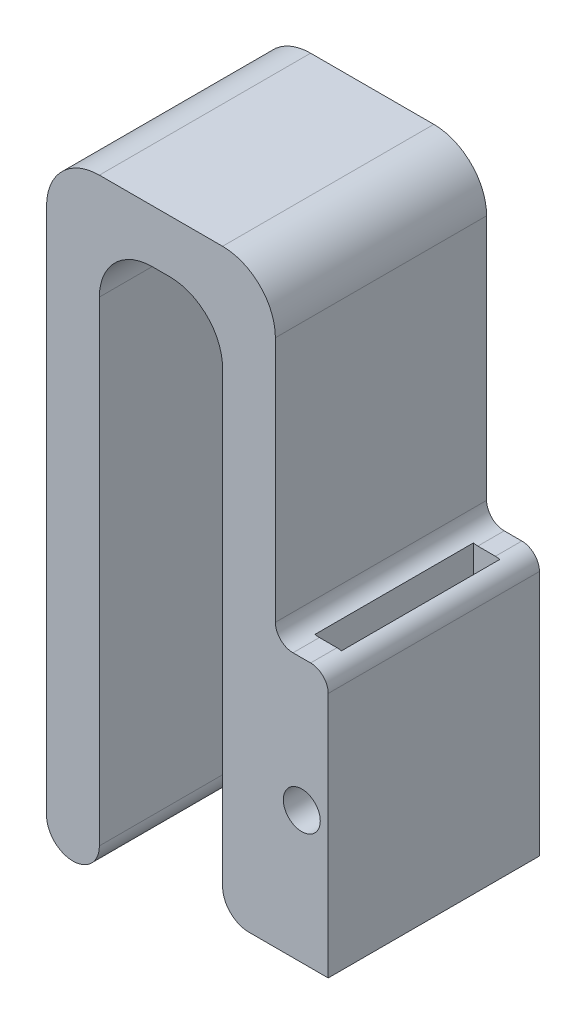
from build123d import *

# Parameters (mm, degrees)
SKETCH1_R           = 1.5
BOSS_EXTRUDE2_DEPTH = 12
SKETCH3_W           = 1.5
SKETCH3_H           = 9
CUT_EXTRUDE2_DEPTH  = 24.832750576
SKETCH4_R           = 1.05
CUT_EXTRUDE3_DEPTH  = 37.510272527
FILLET1_START       = -1
FILLET1_DEPTH       = 14
FILLET1_2_DEPTH     = 12
FILLET1_3_DEPTH     = 1.5
FILLET1_START_2     = 10.5
FILLET1_4_DEPTH     = 1.5


with BuildPart() as part:
    # Sketch1 → Boss-Extrude2 (new body)
    with BuildSketch(Plane.XY):
        with BuildLine():
            ThreePointArc((-10, 0), (-8.5, -1.5), (-7, 0))
            Line((-7, 0), (-10, 0))
        make_face()
        with BuildLine():
            Line((-10, 0), (-7, 0))
            ThreePointArc((-7, 0), (-8.5, 1.5), (-10, 0))
        make_face()
        Polygon((3, 15), (3, 1.5), (3, 0), (6, 0), (6, 15), align=None)
        with BuildLine():
            Line((0, 27), (0, 1.5))
            ThreePointArc((0, 1.5), (1.5, 3), (3, 1.5))
            Line((3, 1.5), (3, 15))
            Line((3, 15), (3, 30))
            ThreePointArc((3, 30), (2.121320344, 32.121320344), (0, 33))
            Line((0, 33), (-7, 33))
            ThreePointArc((-7, 33), (-9.121320344, 32.121320344), (-10, 30))
            Line((-10, 30), (-10, 0))
            ThreePointArc((-10, 0), (-8.5, 1.5), (-7, 0))
            Line((-7, 0), (-7, 27))
            ThreePointArc((-7, 27), (-6.121320344, 29.121320344), (-4, 30))
            Line((-4, 30), (-3, 30))
            ThreePointArc((-3, 30), (-0.878679656, 29.121320344), (0, 27))
        make_face()
        with Locations((1.5, 1.5)):
            Circle(SKETCH1_R)
        with BuildLine():
            ThreePointArc((3, 1.5), (2.560660172, 0.439339828), (1.5, 0))
            Line((1.5, 0), (3, 0))
            Line((3, 0), (3, 1.5))
        make_face()
    extrude(amount=BOSS_EXTRUDE2_DEPTH)

    # Sketch3 → Cut-Extrude2 (cut, through all)
    with BuildSketch(Plane(origin=(0, 15, 0), x_dir=(1, 0, 0), z_dir=(0, 1, 0))):
        with Locations((4.5, -6)):
            Rectangle(SKETCH3_W, SKETCH3_H)
    extrude(amount=-CUT_EXTRUDE2_DEPTH, mode=Mode.SUBTRACT)

    # Sketch4 → Cut-Extrude3 (cut, through all)
    with BuildSketch(Plane.XY.offset(12)):
        with Locations((4.5, 7.5)):
            Circle(SKETCH4_R)
    extrude(amount=-CUT_EXTRUDE3_DEPTH, mode=Mode.SUBTRACT)

    # Fillet1: read off the stored shape, not the designer's step
    # Fillet1 outline → Fillet1 (cut)
    with BuildSketch(Plane.XY.offset(FILLET1_START)):
        with BuildLine():
            Line((6, 14), (6, 15))
            Line((6, 15), (5, 15))
            ThreePointArc((5, 15), (5.707106781, 14.707106781), (6, 14))
        make_face()
    extrude(amount=FILLET1_DEPTH, mode=Mode.SUBTRACT)

    # Fillet1 2 outline → Fillet1 2 (add)
    with BuildSketch(Plane.XY):
        with BuildLine():
            Line((3.75, 15), (3.75, 15.031754164))
            ThreePointArc((3.75, 15.031754164), (3.209430585, 15.387627564), (3, 16))
            Line((3, 16), (3, 15))
            Line((3, 15), (3.75, 15))
        make_face()
    extrude(amount=FILLET1_2_DEPTH)

    # Fillet1 3 outline → Fillet1 3 (add)
    with BuildSketch(Plane.XY):
        with BuildLine():
            Line((3.75, 15), (4, 15))
            ThreePointArc((4, 15), (3.873995708, 15.007970304), (3.75, 15.031754164))
            Line((3.75, 15.031754164), (3.75, 15))
        make_face()
    extrude(amount=FILLET1_3_DEPTH)

    # Fillet1 4 outline → Fillet1 4 (add)
    with BuildSketch(Plane.XY.offset(FILLET1_START_2)):
        with BuildLine():
            Line((3.75, 15), (4, 15))
            ThreePointArc((4, 15), (3.873995708, 15.007970304), (3.75, 15.031754164))
            Line((3.75, 15.031754164), (3.75, 15))
        make_face()
    extrude(amount=FILLET1_4_DEPTH)


solid = part.part
